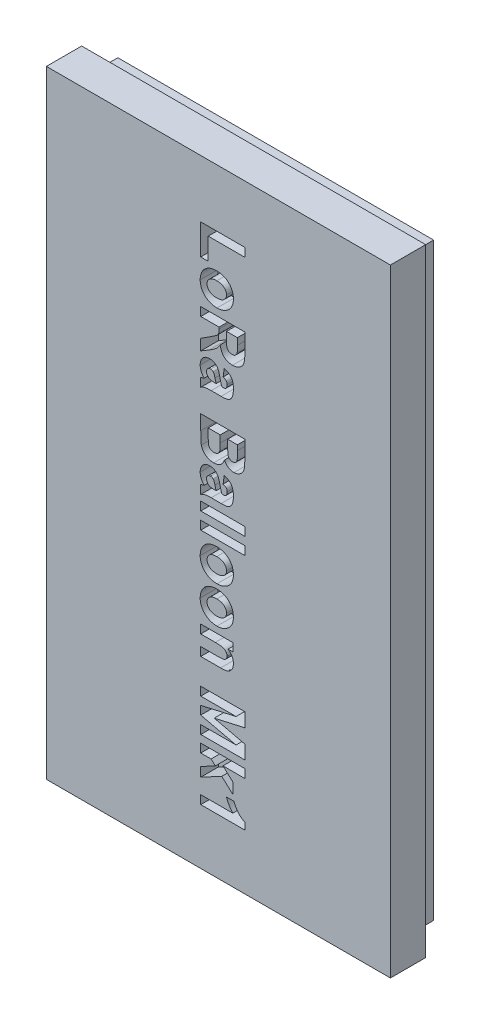
from build123d import *

# Parameters (mm, degrees)
SKETCH1_W           = 39
SKETCH1_H           = 70
BOSS_EXTRUDE1_DEPTH = 4
SKETCH2_W           = 35.8
SKETCH2_H           = 66.8
SKETCH2_W_2         = 32.2
SKETCH2_H_2         = 63.2
BOSS_EXTRUDE2_DEPTH = 2.5
SKETCH3_W           = 5
SKETCH3_H           = 0.974025974
CUT_EXTRUDE1_DEPTH  = 2


with BuildPart() as part:
    # Sketch1 → Boss-Extrude1 (new body)
    with BuildSketch(Plane.XY):
        with Locations((19.5, 35)):
            Rectangle(SKETCH1_W, SKETCH1_H)
    extrude(amount=BOSS_EXTRUDE1_DEPTH)

    # Sketch2 → Boss-Extrude2 (add)
    with BuildSketch(Plane(origin=(0, 0, 0), x_dir=(-1, 0, 0), z_dir=(0, 0, -1))):
        with Locations((-19.5, 35)):
            Rectangle(SKETCH2_W, SKETCH2_H)
        with Locations((-19.5, 35)):
            Rectangle(SKETCH2_W_2, SKETCH2_H_2, mode=Mode.SUBTRACT)
    extrude(amount=BOSS_EXTRUDE2_DEPTH)

    # Sketch3 → Cut-Extrude1 (cut)
    # profile 1 of 14: a face of its own
    with BuildSketch(Plane.XY.offset(4)):
        Polygon((17.5, 63.480519481), (22.5, 63.480519481), (22.5, 62.506493506), (18.344155844, 62.506493506), (18.344155844, 60.038961039), (17.5, 60.038961039), align=None)
    # profile 2 of 14: a face of its own
    with BuildSketch(Plane.XY.offset(4)):
        with BuildLine():
            add(Edge.make_bspline(
                [(19.368912338, 59.584415584), (19.412557514, 59.583528419), (19.49897445, 59.581771843), (19.627236649, 59.5710115), (19.752443405, 59.550019945), (19.874785917, 59.522884131), (19.994516204, 59.488790148), (20.110184764, 59.444132033), (20.223974613, 59.394264811), (20.333175225, 59.334768256), (20.438197721, 59.270617637), (20.536987544, 59.200578377), (20.628149795, 59.124897448), (20.714126756, 59.046482053), (20.791131896, 58.96084051), (20.863823807, 58.87250186), (20.92718966, 58.777238739), (20.985571825, 58.679054138), (21.035971814, 58.57595743), (21.08098851, 58.470239525), (21.116953951, 58.36023349), (21.149170134, 58.248554471), (21.171961312, 58.132698684), (21.189429104, 58.014236637), (21.199791408, 57.892231578), (21.200792678, 57.809881336), (21.201298701, 57.768262987)],
                knots=[0, 0, 0, 0, 1.087797627, 2.153826546, 3.204146119, 4.249074796, 5.276002369, 6.302929943, 7.33671768, 8.369955531, 9.399197913, 10.402506754, 11.384561342, 12.350717656, 13.299250364, 14.252266119, 15.199037181, 16.147307724, 17.097187567, 18.056740571, 19.008264324, 19.97962709, 20.951574749, 21.948063114, 22.962987564, 24, 24, 24, 24], degree=3))
            add(Edge.make_bspline(
                [(21.201298701, 57.768262987), (21.199450512, 57.699196986), (21.195849872, 57.564642667), (21.170584758, 57.368376346), (21.126764803, 57.183837211), (21.066175813, 57.009883847), (20.986134267, 56.848038854), (20.89046985, 56.696280054), (20.776185609, 56.556703738), (20.645110832, 56.431081694), (20.503737769, 56.317759151), (20.354365117, 56.219397997), (20.199648716, 56.135604234), (20.038921137, 56.06728619), (19.872434276, 56.012800493), (19.69920372, 55.976348227), (19.520815843, 55.951385416), (19.399776993, 55.949172654), (19.338474026, 55.948051948)],
                knots=[0, 0, 0, 0, 1.136040707, 2.213233445, 3.248238065, 4.25119704, 5.236487175, 6.211911138, 7.196384178, 8.195725979, 9.1931767, 10.173001403, 11.133846892, 12.083513917, 13.042376269, 14.010298635, 14.992269034, 16, 16, 16, 16], degree=3))
            add(Edge.make_bspline(
                [(19.338474026, 55.948051948), (19.292785106, 55.948788827), (19.202258032, 55.950248863), (19.068171932, 55.963209219), (18.937242639, 55.981822592), (18.809553931, 56.009724143), (18.685290231, 56.044636463), (18.564480208, 56.089004836), (18.44727316, 56.140577304), (18.333494925, 56.199149596), (18.225970918, 56.265135773), (18.123494513, 56.334835969), (18.029544059, 56.411267865), (17.941646307, 56.491770536), (17.860288246, 56.576913906), (17.78604347, 56.667487133), (17.718822759, 56.763088903), (17.659365223, 56.863436801), (17.60640402, 56.967101274), (17.560648674, 57.073877485), (17.522295574, 57.183113435), (17.490858341, 57.294665106), (17.464721949, 57.408267799), (17.448553753, 57.525095631), (17.436196394, 57.643879325), (17.435443702, 57.723924483), (17.435064935, 57.764204545)],
                knots=[0, 0, 0, 0, 1.117558833, 2.214307803, 3.293244786, 4.351421184, 5.409597582, 6.448807362, 7.497331125, 8.540978692, 9.576922014, 10.582241184, 11.570837346, 12.537122916, 13.496974449, 14.449450387, 15.399839374, 16.353464778, 17.300823134, 18.246083241, 19.193441597, 20.131138339, 21.080698472, 22.042616426, 23.015011865, 24, 24, 24, 24], degree=3))
            add(Edge.make_bspline(
                [(17.435064935, 57.764204545), (17.436658538, 57.82819482), (17.439789185, 57.953904305), (17.463432675, 58.138408962), (17.502852243, 58.314388167), (17.558226745, 58.482119319), (17.627904833, 58.641994397), (17.714623801, 58.793107632), (17.81848662, 58.934619784), (17.935324792, 59.068380592), (18.067007303, 59.190741631), (18.213695075, 59.296408751), (18.373969277, 59.385342747), (18.547080851, 59.458460327), (18.733816486, 59.515186359), (18.933919374, 59.555416358), (19.147111308, 59.580032759), (19.2937634, 59.582930629), (19.368912338, 59.584415584)],
                knots=[0, 0, 0, 0, 1.024594995, 2.012826322, 2.973358778, 3.908543225, 4.837401023, 5.761810751, 6.69243552, 7.644223827, 8.602462928, 9.564551743, 10.532007457, 11.531954493, 12.568505162, 13.651979317, 14.796803673, 16, 16, 16, 16], degree=3))
        make_face()
        with BuildLine():
            add(Edge.make_bspline(
                [(19.318181818, 58.61038961), (19.274202345, 58.609514753), (19.188802006, 58.607815935), (19.06447938, 58.597454177), (18.948875339, 58.576133409), (18.840572969, 58.551320566), (18.74158396, 58.514609688), (18.649820783, 58.472887948), (18.56681123, 58.421567934), (18.493039432, 58.362821614), (18.42822013, 58.298508427), (18.370720871, 58.231285957), (18.322007126, 58.160767582), (18.282867351, 58.08637229), (18.252505923, 58.009070471), (18.22979593, 57.928280791), (18.216410588, 57.84413299), (18.214997021, 57.786910979), (18.214285714, 57.758116883)],
                knots=[0, 0, 0, 0, 1.347985487, 2.617548842, 3.817114289, 4.948286482, 6.017057593, 7.046407217, 8.032969353, 8.999289909, 9.930051738, 10.827140183, 11.706817169, 12.550594062, 13.397420762, 14.247349517, 15.118066881, 16, 16, 16, 16], degree=3))
            add(Edge.make_bspline(
                [(18.214285714, 57.758116883), (18.214996693, 57.729997883), (18.216409584, 57.674118493), (18.22979937, 57.591986829), (18.252500735, 57.513209195), (18.283226956, 57.437266744), (18.322589441, 57.364118347), (18.372121703, 57.295009085), (18.429215162, 57.228477216), (18.495143433, 57.165972865), (18.568962581, 57.10742814), (18.652801437, 57.057929707), (18.744850541, 57.016383128), (18.844755807, 56.9820163), (18.95291975, 56.954389132), (19.06972451, 56.935560347), (19.194861198, 56.924502338), (19.280956327, 56.922901926), (19.325284091, 56.922077922)],
                knots=[0, 0, 0, 0, 0.86498205, 1.718932724, 2.552529207, 3.383717481, 4.236080589, 5.102502034, 5.995588818, 6.930639414, 7.894730959, 8.889086482, 9.918564038, 10.998334367, 12.1369617, 13.350269694, 14.635734454, 16, 16, 16, 16], degree=3))
            add(Edge.make_bspline(
                [(19.325284091, 56.922077922), (19.368590511, 56.92294123), (19.452647024, 56.924616887), (19.574907493, 56.935124228), (19.689038528, 56.955995868), (19.795406311, 56.98277939), (19.894048552, 57.017465181), (19.984674312, 57.059961661), (20.067601966, 57.110789288), (20.141273702, 57.170017786), (20.207179656, 57.233571266), (20.264268467, 57.301112354), (20.313794055, 57.371246694), (20.353151989, 57.445402526), (20.383867427, 57.522357638), (20.406564098, 57.602146516), (20.419954045, 57.685284735), (20.421366945, 57.74183557), (20.422077922, 57.770292208)],
                knots=[0, 0, 0, 0, 1.337232047, 2.595528913, 3.783536199, 4.915617704, 5.97906533, 7.006690339, 8.000659516, 8.974235141, 9.919454987, 10.823278711, 11.700968276, 12.565199868, 13.408680491, 14.254935835, 15.121875735, 16, 16, 16, 16], degree=3))
            add(Edge.make_bspline(
                [(20.422077922, 57.770292208), (20.421415795, 57.798756777), (20.420115523, 57.854654965), (20.40626498, 57.937027866), (20.384085777, 58.015940839), (20.353098004, 58.092139731), (20.313828021, 58.165346709), (20.263910312, 58.234471195), (20.207514915, 58.301932386), (20.141196663, 58.364462993), (20.067164898, 58.422965991), (19.98383727, 58.473238788), (19.892800776, 58.516296387), (19.793326134, 58.550568631), (19.686106775, 58.57781848), (19.57038669, 58.59703671), (19.446909753, 58.607908449), (19.361831476, 58.609548287), (19.318181818, 58.61038961)],
                knots=[0, 0, 0, 0, 0.8777483, 1.723705717, 2.56959874, 3.403036217, 4.257705828, 5.126471818, 6.029908573, 6.967489424, 7.934189811, 8.936630112, 9.963815147, 11.036651848, 12.178360317, 13.374360467, 14.652907978, 16, 16, 16, 16], degree=3))
        make_face(mode=Mode.SUBTRACT)
    # profile 3 of 14: a face of its own
    with BuildSketch(Plane.XY.offset(4)):
        with BuildLine():
            Line((17.5, 55.168831169), (22.5, 55.168831169))
            Line((22.5, 55.168831169), (22.5, 53.110186688))
            add(Edge.make_bspline(
                [(22.5, 53.110186688), (22.49959964, 53.046602106), (22.498828535, 52.924136317), (22.493283254, 52.747468762), (22.481516393, 52.585151171), (22.468334076, 52.43675353), (22.44896646, 52.30271048), (22.42582199, 52.182450855), (22.399160183, 52.076128095), (22.35746947, 51.953987396), (22.289037207, 51.817258993), (22.182950283, 51.66927317), (22.052390783, 51.53611038), (21.925015541, 51.43986879), (21.812438114, 51.37314975), (21.723389173, 51.327896019), (21.629222447, 51.291835754), (21.531340355, 51.261110267), (21.429311402, 51.236872009), (21.322862278, 51.219582969), (21.212666288, 51.209296583), (21.137738396, 51.208297549), (21.099837662, 51.207792208)],
                knots=[0, 0, 0, 0, 1.403336213, 2.702867097, 3.89994726, 4.994709233, 5.990128961, 6.887471613, 7.696701944, 8.407207329, 9.732421867, 11.053910544, 12.410433107, 13.833109191, 14.562763883, 15.297137368, 16.03453921, 16.78526912, 17.560138056, 18.346710252, 19.163717375, 20, 20, 20, 20], degree=3))
            add(Edge.make_bspline(
                [(21.099837662, 51.207792208), (21.05209605, 51.208614176), (20.95868939, 51.21022236), (20.822344048, 51.22725247), (20.692703782, 51.252832759), (20.570856368, 51.291197991), (20.454791296, 51.337103071), (20.347190843, 51.396787046), (20.24618256, 51.465982623), (20.152440065, 51.5452996), (20.067090469, 51.635039834), (19.990096905, 51.733862805), (19.920315295, 51.840706945), (19.860965804, 51.957551266), (19.807585822, 52.082277929), (19.764568325, 52.216986165), (19.728740241, 52.360000336), (19.712183605, 52.459007884), (19.703733766, 52.509537338)],
                knots=[0, 0, 0, 0, 1.084141299, 2.12112686, 3.117250271, 4.082180618, 5.019674211, 5.948149429, 6.871043381, 7.797863675, 8.732676681, 9.679570512, 10.640822351, 11.627176691, 12.653315453, 13.72007994, 14.836420889, 16, 16, 16, 16], degree=3))
            add(Edge.make_bspline(
                [(19.703733766, 52.509537338), (19.672285899, 52.457018332), (19.611037345, 52.354731166), (19.509893003, 52.212066964), (19.404961729, 52.083111517), (19.310752977, 51.984867186), (19.227578847, 51.909973227), (19.154264031, 51.850296479), (19.069920557, 51.786454973), (18.973984887, 51.718383278), (18.866785434, 51.645602751), (18.747978614, 51.56859415), (18.617651859, 51.487241259), (18.526522549, 51.432236426), (18.479099026, 51.403612013)],
                knots=[0, 0, 0, 0, 1.316447784, 2.563942512, 3.758196669, 4.89017242, 5.487731481, 6.164970468, 6.923081098, 7.76291089, 8.695186333, 9.710230341, 10.808408125, 12, 12, 12, 12], degree=3))
            Line((18.479099026, 51.403612013), (17.5, 50.818181818))
            Line((17.5, 50.818181818), (17.5, 52.052962662))
            Line((17.5, 52.052962662), (18.576501623, 52.745941558))
            add(Edge.make_bspline(
                [(18.576501623, 52.745941558), (18.622838875, 52.776035915), (18.711185346, 52.833413728), (18.836924232, 52.915199926), (18.948969559, 52.989958436), (19.048256469, 53.055680165), (19.132514105, 53.116606493), (19.204439987, 53.16757582), (19.262804516, 53.211341042), (19.321633384, 53.258982938), (19.380679389, 53.315703915), (19.440089246, 53.3840759), (19.486730917, 53.455464852), (19.523082043, 53.531650484), (19.549023303, 53.620907303), (19.56623292, 53.72849369), (19.575452702, 53.858133753), (19.577057051, 53.951622344), (19.577922078, 54.002029221)],
                knots=[0, 0, 0, 0, 1.540630534, 2.937361724, 4.182336204, 5.296545873, 6.256860607, 7.081241145, 7.754565199, 8.290682583, 9.191113071, 10.033949391, 10.810788607, 11.561665679, 12.379113064, 13.39303176, 14.594383257, 16, 16, 16, 16], degree=3))
            Line((19.577922078, 54.002029221), (19.577922078, 54.194805195))
            Line((19.577922078, 54.194805195), (17.5, 54.194805195))
            Line((17.5, 54.194805195), (17.5, 55.168831169))
        make_face()
        with BuildLine():
            Line((20.422077922, 54.194805195), (20.422077922, 53.480519481))
            add(Edge.make_bspline(
                [(20.422077922, 53.480519481), (20.422360992, 53.428436187), (20.422899583, 53.329338772), (20.424522386, 53.187944599), (20.428762736, 53.061455316), (20.433738572, 52.949833792), (20.439463925, 52.853034526), (20.447175783, 52.771067013), (20.45718866, 52.704030712), (20.471404412, 52.635039214), (20.497429019, 52.56218402), (20.541179974, 52.485039129), (20.595020472, 52.414693496), (20.662845147, 52.354665816), (20.74267145, 52.305026133), (20.835511744, 52.270942117), (20.939989681, 52.25048374), (21.013494264, 52.248038972), (21.052150974, 52.246753247)],
                knots=[0, 0, 0, 0, 1.560937284, 2.96995135, 4.237567709, 5.353650601, 6.318464703, 7.143454388, 7.820048429, 8.348858403, 9.25293029, 10.124191563, 10.998043079, 11.895328271, 12.823620657, 13.798761283, 14.842349086, 16, 16, 16, 16], degree=3))
            add(Edge.make_bspline(
                [(21.052150974, 52.246753247), (21.089110033, 52.248089887), (21.159913547, 52.250650527), (21.260502807, 52.270707591), (21.349801982, 52.30534349), (21.426865286, 52.354919176), (21.492474654, 52.4165156), (21.546236077, 52.488760187), (21.591503058, 52.569477796), (21.609903288, 52.629161273), (21.619318182, 52.659699675)],
                knots=[0, 0, 0, 0, 1.164311867, 2.230505154, 3.21629184, 4.165493112, 5.100643873, 6.036584124, 6.995373831, 8, 8, 8, 8], degree=3))
            add(Edge.make_bspline(
                [(21.619318182, 52.659699675), (21.622152214, 52.673542437), (21.628891215, 52.706458933), (21.636815241, 52.764342618), (21.642174412, 52.838215662), (21.647313084, 52.927849931), (21.651101857, 53.033393596), (21.654449891, 53.155147368), (21.654715225, 53.292818734), (21.655454959, 53.389881783), (21.655844156, 53.440949675)],
                knots=[0, 0, 0, 0, 0.432971861, 1.029557334, 1.788740938, 2.702316591, 3.781055348, 5.025222918, 6.434877167, 8, 8, 8, 8], degree=3))
            Line((21.655844156, 53.440949675), (21.655844156, 54.194805195))
            Line((21.655844156, 54.194805195), (20.422077922, 54.194805195))
        make_face(mode=Mode.SUBTRACT)
    # profile 4 of 14: a face of its own
    with BuildSketch(Plane.XY.offset(4)):
        with BuildLine():
            Line((20.032467532, 49.519480519), (20.162337662, 50.428571429))
            add(Edge.make_bspline(
                [(20.162337662, 50.428571429), (20.20719306, 50.415691623), (20.294450645, 50.390636429), (20.418210578, 50.34335307), (20.533095669, 50.292058446), (20.637670757, 50.2327813), (20.733439233, 50.168522975), (20.818332941, 50.09658976), (20.893880795, 50.019221267), (20.960550687, 49.935474488), (21.018112561, 49.843478314), (21.067731107, 49.742880485), (21.109302392, 49.632741745), (21.142396799, 49.513422221), (21.168715692, 49.384935912), (21.187893956, 49.247034659), (21.198845125, 49.099609618), (21.20046527, 48.998327146), (21.201298701, 48.946225649)],
                knots=[0, 0, 0, 0, 1.125515524, 2.189474865, 3.193709533, 4.158305409, 5.086274303, 5.972285183, 6.837881566, 7.691743787, 8.549806887, 9.451203831, 10.393874208, 11.385866739, 12.435713252, 13.556277782, 14.742906037, 16, 16, 16, 16], degree=3))
            add(Edge.make_bspline(
                [(21.201298701, 48.946225649), (21.201065942, 48.899877691), (21.200613715, 48.809828678), (21.192639745, 48.678941652), (21.183453447, 48.556293549), (21.168254125, 48.442124789), (21.147871153, 48.336527011), (21.123918854, 48.239177262), (21.095484812, 48.150333568), (21.053298642, 48.045537469), (20.990036334, 47.930029242), (20.901736264, 47.808898551), (20.798905797, 47.710331005), (20.701948242, 47.644080397), (20.613079567, 47.60315076), (20.533918189, 47.577669987), (20.442731226, 47.555247458), (20.339287857, 47.537500848), (20.223475224, 47.523487201), (20.095514823, 47.513621989), (19.955416661, 47.507532466), (19.857961248, 47.506849219), (19.807224026, 47.506493506)],
                knots=[0, 0, 0, 0, 1.172645795, 2.278322549, 3.317437237, 4.284552983, 5.190951134, 6.037858116, 6.820064311, 7.549551753, 8.893788561, 10.141635195, 11.328036199, 12.481663495, 13.094362176, 13.79803918, 14.582676335, 15.469136844, 16.45214095, 17.533908717, 18.716103928, 20, 20, 20, 20], degree=3))
            Line((19.807224026, 47.506493506), (18.689123377, 47.51461039))
            add(Edge.make_bspline(
                [(18.689123377, 47.51461039), (18.651245726, 47.514294596), (18.577852753, 47.513682703), (18.471594239, 47.512431592), (18.372858153, 47.506800527), (18.281554432, 47.500655264), (18.197471505, 47.494505328), (18.121165633, 47.483591402), (18.052284959, 47.473158955), (17.969560894, 47.455108068), (17.869356028, 47.42503735), (17.74867523, 47.378093511), (17.624021205, 47.319072636), (17.542270007, 47.271401782), (17.5, 47.246753247)],
                knots=[0, 0, 0, 0, 1.100960395, 2.13325684, 3.08799504, 3.974623839, 4.793377983, 5.537123068, 6.214225653, 6.817686965, 7.996461938, 9.250537039, 10.578371695, 12, 12, 12, 12], degree=3))
            Line((17.5, 47.246753247), (17.5, 48.220779221))
            Line((17.5, 48.220779221), (17.897727273, 48.339488636))
            add(Edge.make_bspline(
                [(17.897727273, 48.339488636), (17.859360735, 48.378659846), (17.784707234, 48.454879074), (17.688641004, 48.579374361), (17.607826166, 48.707185677), (17.543543882, 48.840060964), (17.494429822, 48.977200236), (17.460175543, 49.118356728), (17.439245859, 49.263849149), (17.436470563, 49.362146366), (17.435064935, 49.411931818)],
                knots=[0, 0, 0, 0, 1.094238684, 2.129166538, 3.133671034, 4.10942336, 5.070833053, 6.037377746, 7.005973528, 8, 8, 8, 8], degree=3))
            add(Edge.make_bspline(
                [(17.435064935, 49.411931818), (17.436196198, 49.452883747), (17.438417837, 49.533307461), (17.451225957, 49.651233519), (17.474624664, 49.763299387), (17.5076296, 49.869303813), (17.547536028, 49.970535302), (17.599137275, 50.065280202), (17.658950235, 50.154839855), (17.72770078, 50.238115806), (17.804914915, 50.312403446), (17.886913645, 50.37988358), (17.977266308, 50.433812533), (18.071973861, 50.480965293), (18.174096818, 50.514377114), (18.281528935, 50.540376537), (18.395128698, 50.555597497), (18.472967275, 50.557482325), (18.512581169, 50.558441558)],
                knots=[0, 0, 0, 0, 1.111028414, 2.181900458, 3.212888925, 4.21115239, 5.190734394, 6.159429897, 7.131421471, 8.108723925, 9.081883785, 10.034678926, 10.981892532, 11.929727932, 12.898727489, 13.888948844, 14.925636122, 16, 16, 16, 16], degree=3))
            add(Edge.make_bspline(
                [(18.512581169, 50.558441558), (18.562728581, 50.556889309), (18.660210948, 50.553871867), (18.801417536, 50.530305427), (18.932652513, 50.49093437), (19.053137607, 50.434421777), (19.162868726, 50.36437675), (19.262007438, 50.281256988), (19.348206816, 50.183941956), (19.411268145, 50.092633998), (19.457348311, 50.010976391), (19.488801873, 49.939353837), (19.521903707, 49.860662202), (19.551693844, 49.772493261), (19.582392237, 49.676262773), (19.611730086, 49.571066917), (19.638745813, 49.456793731), (19.656154942, 49.377796886), (19.665178571, 49.336850649)],
                knots=[0, 0, 0, 0, 1.294162278, 2.515743014, 3.684113667, 4.820865117, 5.939906549, 7.036651616, 8.149715676, 9.285662014, 9.895437351, 10.567486448, 11.303637924, 12.098932185, 12.968810962, 13.91153998, 14.917493754, 16, 16, 16, 16], degree=3))
            add(Edge.make_bspline(
                [(19.665178571, 49.336850649), (19.675447193, 49.287425487), (19.695178402, 49.192454782), (19.727063699, 49.056316793), (19.757224442, 48.931779605), (19.786558499, 48.818685487), (19.815533819, 48.717366448), (19.845353454, 48.627940328), (19.873024169, 48.549807839), (19.893250832, 48.502417949), (19.902597403, 48.480519481)],
                knots=[0, 0, 0, 0, 1.361164628, 2.615484881, 3.770095419, 4.816364149, 5.765912261, 6.610903979, 7.358110453, 8, 8, 8, 8], degree=3))
            add(Edge.make_bspline(
                [(19.902597403, 48.480519481), (19.946562127, 48.481232522), (20.026443529, 48.482528078), (20.134084546, 48.488297217), (20.217051281, 48.500778797), (20.279754281, 48.51823568), (20.326272153, 48.546991338), (20.366333468, 48.581441425), (20.40050469, 48.626229317), (20.431853941, 48.678910853), (20.457013728, 48.742456573), (20.475081855, 48.817171002), (20.484463112, 48.903377417), (20.486127741, 48.964468224), (20.487012987, 48.996956169)],
                knots=[0, 0, 0, 0, 1.704637254, 3.09722893, 4.172654963, 4.956246112, 5.596985007, 6.275246559, 6.99385986, 7.769515704, 8.645866914, 9.631493719, 10.740434052, 12, 12, 12, 12], degree=3))
            add(Edge.make_bspline(
                [(20.487012987, 48.996956169), (20.486048403, 49.030216444), (20.484220622, 49.093241041), (20.46511142, 49.182020678), (20.436865352, 49.260706291), (20.392081016, 49.328409486), (20.331148168, 49.387726745), (20.250139095, 49.438941536), (20.148822864, 49.484227608), (20.07303212, 49.50719041), (20.032467532, 49.519480519)],
                knots=[0, 0, 0, 0, 1.045871977, 1.981813381, 2.848317391, 3.663751395, 4.514929533, 5.507645304, 6.666046366, 8, 8, 8, 8], degree=3))
        make_face()
        with BuildLine():
            add(Edge.make_bspline(
                [(19.253246753, 48.480519481), (19.242902471, 48.510215942), (19.219887127, 48.576288602), (19.186657715, 48.687280513), (19.151554448, 48.820434594), (19.127949707, 48.916761496), (19.11525974, 48.968547078)],
                knots=[0, 0, 0, 0, 0.743632693, 1.654533494, 2.73907137, 4, 4, 4, 4], degree=3))
            add(Edge.make_bspline(
                [(19.11525974, 48.968547078), (19.107773576, 48.999066387), (19.09347914, 49.057341404), (19.068312447, 49.139900909), (19.045017306, 49.214838789), (19.018856579, 49.281109366), (18.994468642, 49.339977222), (18.967850056, 49.390138496), (18.940858395, 49.432128311), (18.920695301, 49.455743787), (18.911323052, 49.466720779)],
                knots=[0, 0, 0, 0, 1.388607462, 2.65147299, 3.814389992, 4.855436495, 5.799565367, 6.62877246, 7.362623276, 8, 8, 8, 8], degree=3))
            add(Edge.make_bspline(
                [(18.911323052, 49.466720779), (18.8921243, 49.48498234), (18.854201425, 49.521054002), (18.783420009, 49.55770184), (18.705480812, 49.580926081), (18.650404864, 49.583232655), (18.622159091, 49.584415584)],
                knots=[0, 0, 0, 0, 0.985740837, 1.947112291, 2.947173789, 4, 4, 4, 4], degree=3))
            add(Edge.make_bspline(
                [(18.622159091, 49.584415584), (18.589843357, 49.583021662), (18.527262696, 49.580322278), (18.437477164, 49.554408327), (18.355250624, 49.514023038), (18.283687216, 49.456492464), (18.22311162, 49.388656918), (18.18117901, 49.308680508), (18.153141138, 49.221698667), (18.150630123, 49.160194587), (18.149350649, 49.128855519)],
                knots=[0, 0, 0, 0, 1.056198986, 2.045369905, 3.036276429, 4.038084886, 5.035473036, 5.992159802, 6.976916006, 8, 8, 8, 8], degree=3))
            add(Edge.make_bspline(
                [(18.149350649, 49.128855519), (18.150811117, 49.099659231), (18.153749602, 49.040915817), (18.175060673, 48.953250177), (18.210348574, 48.866593217), (18.257143782, 48.781964229), (18.313408733, 48.704238415), (18.377238864, 48.638276618), (18.445522965, 48.584698065), (18.508215375, 48.550164762), (18.564336552, 48.52974552), (18.614132649, 48.517350335), (18.671106722, 48.504488836), (18.73599926, 48.496175812), (18.8083937, 48.488942309), (18.888609575, 48.484087177), (18.976572048, 48.481042641), (19.037808259, 48.480698276), (19.069602273, 48.480519481)],
                knots=[0, 0, 0, 0, 1.093500888, 2.200141778, 3.360346716, 4.591280596, 5.815607582, 6.94487563, 8.019710678, 9.057444999, 9.610729159, 10.253199895, 10.979011171, 11.798077413, 12.702238226, 13.705425431, 14.808650418, 16, 16, 16, 16], degree=3))
            Line((19.069602273, 48.480519481), (19.253246753, 48.480519481))
        make_face(mode=Mode.SUBTRACT)
    # profile 5 of 14: a face of its own
    with BuildSketch(Plane.XY.offset(4)):
        with BuildLine():
            Line((22.5, 44.649350649), (22.5, 42.67288961))
            add(Edge.make_bspline(
                [(22.5, 42.67288961), (22.499510508, 42.607953461), (22.498569611, 42.483133666), (22.49422381, 42.303102482), (22.483811423, 42.138364666), (22.470564301, 41.988512548), (22.455512523, 41.853521205), (22.43354904, 41.733531783), (22.410454756, 41.628078623), (22.372346197, 41.508564591), (22.311256991, 41.374074499), (22.214593191, 41.227673845), (22.095034223, 41.094011681), (21.97810006, 40.996078395), (21.8757626, 40.925997023), (21.795897158, 40.878833509), (21.712358841, 40.840481963), (21.626704996, 40.8092457), (21.539220203, 40.78290298), (21.448294252, 40.766638427), (21.355175757, 40.754383036), (21.291979777, 40.753627393), (21.260146104, 40.753246753)],
                knots=[0, 0, 0, 0, 1.498327689, 2.88007457, 4.154414764, 5.305986542, 6.351317343, 7.286582663, 8.11946184, 8.840080679, 10.177555878, 11.512935148, 12.872513647, 14.301275782, 15.019863751, 15.733221227, 16.438466007, 17.137161526, 17.836031326, 18.543086972, 19.26611006, 20, 20, 20, 20], degree=3))
            add(Edge.make_bspline(
                [(21.260146104, 40.753246753), (21.202105001, 40.755485812), (21.087543876, 40.759905252), (20.920765624, 40.79810736), (20.761932145, 40.858055109), (20.615000736, 40.943704109), (20.481401724, 41.047765172), (20.364799949, 41.167606909), (20.265191479, 41.301102254), (20.216326185, 41.400377793), (20.191761364, 41.450284091)],
                knots=[0, 0, 0, 0, 1.031817477, 2.036594177, 3.029254201, 4.043130586, 5.050931669, 6.034203586, 7.01178454, 8, 8, 8, 8], degree=3))
            add(Edge.make_bspline(
                [(20.191761364, 41.450284091), (20.180408131, 41.416287018), (20.157967235, 41.349088119), (20.116343614, 41.252659833), (20.06809293, 41.162227014), (20.015869675, 41.076187911), (19.955607962, 40.997337562), (19.890207728, 40.92405518), (19.820283436, 40.855071709), (19.742926309, 40.794197199), (19.662096521, 40.737461267), (19.575284811, 40.69015268), (19.484730675, 40.649429465), (19.389910421, 40.615433398), (19.290221661, 40.590554622), (19.186475614, 40.572312866), (19.078647266, 40.560901805), (19.005371576, 40.559270435), (18.968141234, 40.558441558)],
                knots=[0, 0, 0, 0, 1.053917501, 2.08318216, 3.084375989, 4.067115349, 5.039987852, 5.998256831, 6.954975631, 7.924383767, 8.890110205, 9.856297623, 10.826929889, 11.808561028, 12.814635272, 13.844956918, 14.905053061, 16, 16, 16, 16], degree=3))
            add(Edge.make_bspline(
                [(18.968141234, 40.558441558), (18.9227856, 40.559463749), (18.833877117, 40.5614675), (18.70319974, 40.575812502), (18.577900082, 40.600017259), (18.458161501, 40.634652918), (18.343560388, 40.678337479), (18.234505267, 40.732361982), (18.130887303, 40.796661174), (18.032915411, 40.869422249), (17.942563815, 40.948763771), (17.860795079, 41.032806893), (17.787141142, 41.119564208), (17.724510591, 41.211716821), (17.669294272, 41.306011839), (17.623026085, 41.403869017), (17.587612024, 41.505811991), (17.570479131, 41.575607427), (17.561891234, 41.610592532)],
                knots=[0, 0, 0, 0, 1.145607172, 2.24567906, 3.316329682, 4.365460088, 5.390414304, 6.410550385, 7.434792233, 8.46684308, 9.489944109, 10.468671886, 11.426900475, 12.36059261, 13.279351643, 14.185149476, 15.09030244, 16, 16, 16, 16], degree=3))
            add(Edge.make_bspline(
                [(17.561891234, 41.610592532), (17.556921702, 41.639303553), (17.545619634, 41.704600237), (17.532705073, 41.815630372), (17.523758584, 41.951103494), (17.513827495, 42.111024653), (17.50891179, 42.29544384), (17.503367379, 42.504435965), (17.500552852, 42.737817581), (17.500190272, 42.90151478), (17.5, 42.987418831)],
                knots=[0, 0, 0, 0, 0.506837559, 1.152686718, 1.943271314, 2.868501158, 3.939884368, 5.152247396, 6.505573166, 8, 8, 8, 8], degree=3))
            Line((17.5, 42.987418831), (17.5, 44.649350649))
            Line((17.5, 44.649350649), (22.5, 44.649350649))
        make_face()
        with BuildLine():
            Line((21.655844156, 43.675324675), (20.551948052, 43.675324675))
            Line((20.551948052, 43.675324675), (20.551948052, 43.011769481))
            add(Edge.make_bspline(
                [(20.551948052, 43.011769481), (20.551832573, 42.964420376), (20.551613161, 42.874455737), (20.553078644, 42.746619834), (20.553523744, 42.632968979), (20.556054718, 42.53355312), (20.557413467, 42.448626051), (20.561000441, 42.377977453), (20.563239725, 42.321405165), (20.566697363, 42.28834243), (20.568181818, 42.274147727)],
                knots=[0, 0, 0, 0, 1.539755574, 2.925579234, 4.157432792, 5.235486124, 6.159601295, 6.919197766, 7.535983151, 8, 8, 8, 8], degree=3))
            add(Edge.make_bspline(
                [(20.568181818, 42.274147727), (20.574850885, 42.233318916), (20.587561075, 42.155505632), (20.623558152, 42.046431326), (20.673053822, 41.95161873), (20.735797333, 41.87023717), (20.812202827, 41.80538307), (20.902673883, 41.759958125), (21.004824377, 41.731851843), (21.077324625, 41.728840143), (21.115056818, 41.727272727)],
                knots=[0, 0, 0, 0, 1.156043088, 2.203236031, 3.197816213, 4.134692963, 5.061434266, 5.975433912, 6.946330216, 8, 8, 8, 8], degree=3))
            add(Edge.make_bspline(
                [(21.115056818, 41.727272727), (21.149032561, 41.728367007), (21.214080817, 41.730462061), (21.306372262, 41.753914247), (21.389289762, 41.790138513), (21.46058487, 41.842794), (21.519444964, 41.905725062), (21.568910588, 41.974318265), (21.603119906, 42.050430891), (21.622591975, 42.120766342), (21.633137435, 42.189338769), (21.637857773, 42.260943637), (21.644929767, 42.352168788), (21.647622572, 42.462874611), (21.652717015, 42.593373033), (21.653579458, 42.743241676), (21.656517581, 42.91266634), (21.656076539, 43.032059799), (21.655844156, 43.094967532)],
                knots=[0, 0, 0, 0, 0.973031789, 1.862917975, 2.714444411, 3.555113712, 4.385861934, 5.180259999, 5.970734499, 6.766732084, 7.267820327, 7.959442945, 8.825288207, 9.893716152, 11.136763095, 12.573466007, 14.194578749, 16, 16, 16, 16], degree=3))
            Line((21.655844156, 43.094967532), (21.655844156, 43.675324675))
        make_face(mode=Mode.SUBTRACT)
        with BuildLine():
            Line((19.707792208, 43.675324675), (18.344155844, 43.675324675))
            Line((18.344155844, 43.675324675), (18.344155844, 42.766233766))
            add(Edge.make_bspline(
                [(18.344155844, 42.766233766), (18.344435303, 42.718547013), (18.344968481, 42.627565962), (18.346641239, 42.498007918), (18.350663013, 42.381978963), (18.356469428, 42.279101151), (18.364765581, 42.189499659), (18.373086671, 42.113174385), (18.384557964, 42.05062612), (18.39957062, 41.98492682), (18.429541772, 41.914725809), (18.476477375, 41.839130124), (18.536381147, 41.769891211), (18.609251223, 41.709452134), (18.694258039, 41.659140716), (18.790519448, 41.622489145), (18.897872497, 41.601068618), (18.972775625, 41.598657699), (19.011769481, 41.597402597)],
                knots=[0, 0, 0, 0, 1.468823539, 2.802352852, 3.990613231, 5.044577628, 5.97542194, 6.762296442, 7.407977832, 7.933490854, 8.834961323, 9.742609811, 10.665728169, 11.642033707, 12.646065455, 13.694610711, 14.799836276, 16, 16, 16, 16], degree=3))
            add(Edge.make_bspline(
                [(19.011769481, 41.597402597), (19.051778275, 41.599020552), (19.128740306, 41.602132894), (19.239002361, 41.624211472), (19.337981776, 41.66306157), (19.42512846, 41.717703956), (19.500471478, 41.784762229), (19.562788623, 41.863068947), (19.613692581, 41.950567204), (19.644200012, 42.033261763), (19.662826125, 42.109634469), (19.674179052, 42.180962413), (19.685933, 42.265086938), (19.69291111, 42.363053142), (19.700780449, 42.473920979), (19.703815078, 42.598478993), (19.70740735, 42.736113144), (19.707660088, 42.832518088), (19.707792208, 42.882913961)],
                knots=[0, 0, 0, 0, 1.143215143, 2.19912046, 3.197116365, 4.165365694, 5.123819291, 6.065802965, 7.014162653, 8.005206416, 8.5725482, 9.259043701, 10.068343003, 10.999502645, 12.064921609, 13.244816419, 14.559722402, 16, 16, 16, 16], degree=3))
            Line((19.707792208, 42.882913961), (19.707792208, 43.675324675))
        make_face(mode=Mode.SUBTRACT)
    # profile 6 of 14: a face of its own
    with BuildSketch(Plane.XY.offset(4)):
        with BuildLine():
            Line((20.032467532, 39), (20.162337662, 39.909090909))
            add(Edge.make_bspline(
                [(20.162337662, 39.909090909), (20.20719306, 39.896211104), (20.294450645, 39.87115591), (20.418210578, 39.823872551), (20.533095669, 39.772577927), (20.637670757, 39.71330078), (20.733439233, 39.649042456), (20.818332941, 39.577109241), (20.893880795, 39.499740748), (20.960550687, 39.415993968), (21.018112561, 39.323997794), (21.067731107, 39.223399966), (21.109302392, 39.113261226), (21.142396799, 38.993941702), (21.168715692, 38.865455392), (21.187893956, 38.72755414), (21.198845125, 38.580129098), (21.20046527, 38.478846626), (21.201298701, 38.42674513)],
                knots=[0, 0, 0, 0, 1.125515524, 2.189474865, 3.193709533, 4.158305409, 5.086274303, 5.972285183, 6.837881566, 7.691743787, 8.549806887, 9.451203831, 10.393874208, 11.385866739, 12.435713252, 13.556277782, 14.742906037, 16, 16, 16, 16], degree=3))
            add(Edge.make_bspline(
                [(21.201298701, 38.42674513), (21.201065942, 38.380397172), (21.200613715, 38.290348158), (21.192639745, 38.159461132), (21.183453447, 38.03681303), (21.168254125, 37.922644269), (21.147871153, 37.817046491), (21.123918854, 37.719696742), (21.095484812, 37.630853049), (21.053298642, 37.52605695), (20.990036334, 37.410548722), (20.901736264, 37.289418032), (20.798905797, 37.190850485), (20.701948242, 37.124599878), (20.613079567, 37.08367024), (20.533918189, 37.058189468), (20.442731226, 37.035766939), (20.339287857, 37.018020328), (20.223475224, 37.004006681), (20.095514823, 36.994141469), (19.955416661, 36.988051947), (19.857961248, 36.987368699), (19.807224026, 36.987012987)],
                knots=[0, 0, 0, 0, 1.172645795, 2.278322549, 3.317437237, 4.284552983, 5.190951134, 6.037858116, 6.820064311, 7.549551753, 8.893788561, 10.141635195, 11.328036199, 12.481663495, 13.094362176, 13.79803918, 14.582676335, 15.469136844, 16.45214095, 17.533908717, 18.716103928, 20, 20, 20, 20], degree=3))
            Line((19.807224026, 36.987012987), (18.689123377, 36.99512987))
            add(Edge.make_bspline(
                [(18.689123377, 36.99512987), (18.651245726, 36.994814076), (18.577852753, 36.994202183), (18.471594239, 36.992951072), (18.372858153, 36.987320007), (18.281554432, 36.981174744), (18.197471505, 36.975024809), (18.121165633, 36.964110883), (18.052284959, 36.953678435), (17.969560894, 36.935627548), (17.869356028, 36.90555683), (17.74867523, 36.858612991), (17.624021205, 36.799592116), (17.542270007, 36.751921263), (17.5, 36.727272727)],
                knots=[0, 0, 0, 0, 1.100960395, 2.13325684, 3.08799504, 3.974623839, 4.793377983, 5.537123068, 6.214225653, 6.817686965, 7.996461938, 9.250537039, 10.578371695, 12, 12, 12, 12], degree=3))
            Line((17.5, 36.727272727), (17.5, 37.701298701))
            Line((17.5, 37.701298701), (17.897727273, 37.820008117))
            add(Edge.make_bspline(
                [(17.897727273, 37.820008117), (17.859360735, 37.859179326), (17.784707234, 37.935398555), (17.688641004, 38.059893842), (17.607826166, 38.187705157), (17.543543882, 38.320580444), (17.494429822, 38.457719716), (17.460175543, 38.598876208), (17.439245859, 38.74436863), (17.436470563, 38.842665847), (17.435064935, 38.892451299)],
                knots=[0, 0, 0, 0, 1.094238684, 2.129166538, 3.133671034, 4.10942336, 5.070833053, 6.037377746, 7.005973528, 8, 8, 8, 8], degree=3))
            add(Edge.make_bspline(
                [(17.435064935, 38.892451299), (17.436196198, 38.933403227), (17.438417837, 39.013826941), (17.451225957, 39.131752999), (17.474624664, 39.243818867), (17.5076296, 39.349823293), (17.547536028, 39.451054783), (17.599137275, 39.545799682), (17.658950235, 39.635359335), (17.72770078, 39.718635287), (17.804914915, 39.792922926), (17.886913645, 39.86040306), (17.977266308, 39.914332014), (18.071973861, 39.961484773), (18.174096818, 39.994896594), (18.281528935, 40.020896018), (18.395128698, 40.036116978), (18.472967275, 40.038001805), (18.512581169, 40.038961039)],
                knots=[0, 0, 0, 0, 1.111028414, 2.181900458, 3.212888925, 4.21115239, 5.190734394, 6.159429897, 7.131421471, 8.108723925, 9.081883785, 10.034678926, 10.981892532, 11.929727932, 12.898727489, 13.888948844, 14.925636122, 16, 16, 16, 16], degree=3))
            add(Edge.make_bspline(
                [(18.512581169, 40.038961039), (18.562728581, 40.03740879), (18.660210948, 40.034391347), (18.801417536, 40.010824907), (18.932652513, 39.971453851), (19.053137607, 39.914941257), (19.162868726, 39.844896231), (19.262007438, 39.761776468), (19.348206816, 39.664461437), (19.411268145, 39.573153479), (19.457348311, 39.491495871), (19.488801873, 39.419873318), (19.521903707, 39.341181682), (19.551693844, 39.253012742), (19.582392237, 39.156782254), (19.611730086, 39.051586397), (19.638745813, 38.937313211), (19.656154942, 38.858316366), (19.665178571, 38.81737013)],
                knots=[0, 0, 0, 0, 1.294162278, 2.515743014, 3.684113667, 4.820865117, 5.939906549, 7.036651616, 8.149715676, 9.285662014, 9.895437351, 10.567486448, 11.303637924, 12.098932185, 12.968810962, 13.91153998, 14.917493754, 16, 16, 16, 16], degree=3))
            add(Edge.make_bspline(
                [(19.665178571, 38.81737013), (19.675447193, 38.767944968), (19.695178402, 38.672974263), (19.727063699, 38.536836273), (19.757224442, 38.412299085), (19.786558499, 38.299204968), (19.815533819, 38.197885928), (19.845353454, 38.108459808), (19.873024169, 38.03032732), (19.893250832, 37.982937429), (19.902597403, 37.961038961)],
                knots=[0, 0, 0, 0, 1.361164628, 2.615484881, 3.770095419, 4.816364149, 5.765912261, 6.610903979, 7.358110453, 8, 8, 8, 8], degree=3))
            add(Edge.make_bspline(
                [(19.902597403, 37.961038961), (19.946562127, 37.961752003), (20.026443529, 37.963047558), (20.134084546, 37.968816697), (20.217051281, 37.981298278), (20.279754281, 37.99875516), (20.326272153, 38.027510819), (20.366333468, 38.061960905), (20.40050469, 38.106748797), (20.431853941, 38.159430334), (20.457013728, 38.222976054), (20.475081855, 38.297690482), (20.484463112, 38.383896898), (20.486127741, 38.444987705), (20.487012987, 38.477475649)],
                knots=[0, 0, 0, 0, 1.704637254, 3.09722893, 4.172654963, 4.956246112, 5.596985007, 6.275246559, 6.99385986, 7.769515704, 8.645866914, 9.631493719, 10.740434052, 12, 12, 12, 12], degree=3))
            add(Edge.make_bspline(
                [(20.487012987, 38.477475649), (20.486048403, 38.510735925), (20.484220622, 38.573760521), (20.46511142, 38.662540159), (20.436865352, 38.741225771), (20.392081016, 38.808928966), (20.331148168, 38.868246226), (20.250139095, 38.919461016), (20.148822864, 38.964747089), (20.07303212, 38.98770989), (20.032467532, 39)],
                knots=[0, 0, 0, 0, 1.045871977, 1.981813381, 2.848317391, 3.663751395, 4.514929533, 5.507645304, 6.666046366, 8, 8, 8, 8], degree=3))
        make_face()
        with BuildLine():
            add(Edge.make_bspline(
                [(19.253246753, 37.961038961), (19.242902471, 37.990735422), (19.219887127, 38.056808082), (19.186657715, 38.167799993), (19.151554448, 38.300954074), (19.127949707, 38.397280976), (19.11525974, 38.449066558)],
                knots=[0, 0, 0, 0, 0.743632693, 1.654533494, 2.73907137, 4, 4, 4, 4], degree=3))
            add(Edge.make_bspline(
                [(19.11525974, 38.449066558), (19.107773576, 38.479585867), (19.09347914, 38.537860884), (19.068312447, 38.62042039), (19.045017306, 38.695358269), (19.018856579, 38.761628846), (18.994468642, 38.820496703), (18.967850056, 38.870657977), (18.940858395, 38.912647791), (18.920695301, 38.936263267), (18.911323052, 38.94724026)],
                knots=[0, 0, 0, 0, 1.388607462, 2.65147299, 3.814389992, 4.855436495, 5.799565367, 6.62877246, 7.362623276, 8, 8, 8, 8], degree=3))
            add(Edge.make_bspline(
                [(18.911323052, 38.94724026), (18.8921243, 38.965501821), (18.854201425, 39.001573483), (18.783420009, 39.038221321), (18.705480812, 39.061445562), (18.650404864, 39.063752135), (18.622159091, 39.064935065)],
                knots=[0, 0, 0, 0, 0.985740837, 1.947112291, 2.947173789, 4, 4, 4, 4], degree=3))
            add(Edge.make_bspline(
                [(18.622159091, 39.064935065), (18.589843357, 39.063541143), (18.527262696, 39.060841758), (18.437477164, 39.034927808), (18.355250624, 38.994542518), (18.283687216, 38.937011945), (18.22311162, 38.869176399), (18.18117901, 38.789199989), (18.153141138, 38.702218147), (18.150630123, 38.640714067), (18.149350649, 38.609375)],
                knots=[0, 0, 0, 0, 1.056198986, 2.045369905, 3.036276429, 4.038084886, 5.035473036, 5.992159802, 6.976916006, 8, 8, 8, 8], degree=3))
            add(Edge.make_bspline(
                [(18.149350649, 38.609375), (18.150811117, 38.580178711), (18.153749602, 38.521435298), (18.175060673, 38.433769658), (18.210348574, 38.347112698), (18.257143782, 38.26248371), (18.313408733, 38.184757896), (18.377238864, 38.118796099), (18.445522965, 38.065217546), (18.508215375, 38.030684242), (18.564336552, 38.010265001), (18.614132649, 37.997869815), (18.671106722, 37.985008317), (18.73599926, 37.976695293), (18.8083937, 37.96946179), (18.888609575, 37.964606658), (18.976572048, 37.961562122), (19.037808259, 37.961217756), (19.069602273, 37.961038961)],
                knots=[0, 0, 0, 0, 1.093500888, 2.200141778, 3.360346716, 4.591280596, 5.815607582, 6.94487563, 8.019710678, 9.057444999, 9.610729159, 10.253199895, 10.979011171, 11.798077413, 12.702238226, 13.705425431, 14.808650418, 16, 16, 16, 16], degree=3))
            Line((19.069602273, 37.961038961), (19.253246753, 37.961038961))
        make_face(mode=Mode.SUBTRACT)
    # profile 7 of 14: a face of its own
    with BuildSketch(Plane.XY.offset(4)):
        with Locations((20, 35.590909091)):
            Rectangle(SKETCH3_W, SKETCH3_H)
    # profile 8 of 14: a face of its own
    with BuildSketch(Plane.XY.offset(4)):
        with Locations((20, 33.707792208)):
            Rectangle(SKETCH3_W, SKETCH3_H)
    # profile 9 of 14: a face of its own
    with BuildSketch(Plane.XY.offset(4)):
        with BuildLine():
            add(Edge.make_bspline(
                [(19.368912338, 32.506493506), (19.412557514, 32.505606341), (19.49897445, 32.503849765), (19.627236649, 32.493089423), (19.752443405, 32.472097867), (19.874785917, 32.444962053), (19.994516204, 32.41086807), (20.110184764, 32.366209955), (20.223974613, 32.316342733), (20.333175225, 32.256846178), (20.438197721, 32.192695559), (20.536987544, 32.1226563), (20.628149795, 32.04697537), (20.714126756, 31.968559975), (20.791131896, 31.882918432), (20.863823807, 31.794579782), (20.92718966, 31.699316661), (20.985571825, 31.60113206), (21.035971814, 31.498035352), (21.08098851, 31.392317447), (21.116953951, 31.282311412), (21.149170134, 31.170632393), (21.171961312, 31.054776606), (21.189429104, 30.936314559), (21.199791408, 30.8143095), (21.200792678, 30.731959258), (21.201298701, 30.690340909)],
                knots=[0, 0, 0, 0, 1.087797627, 2.153826546, 3.204146119, 4.249074796, 5.276002369, 6.302929943, 7.33671768, 8.369955531, 9.399197913, 10.402506754, 11.384561342, 12.350717656, 13.299250364, 14.252266119, 15.199037181, 16.147307724, 17.097187567, 18.056740571, 19.008264324, 19.97962709, 20.951574749, 21.948063114, 22.962987564, 24, 24, 24, 24], degree=3))
            add(Edge.make_bspline(
                [(21.201298701, 30.690340909), (21.199450512, 30.621274908), (21.195849872, 30.486720589), (21.170584758, 30.290454268), (21.126764803, 30.105915134), (21.066175813, 29.931961769), (20.986134267, 29.770116776), (20.89046985, 29.618357976), (20.776185609, 29.47878166), (20.645110832, 29.353159616), (20.503737769, 29.239837073), (20.354365117, 29.141475919), (20.199648716, 29.057682156), (20.038921137, 28.989364112), (19.872434276, 28.934878415), (19.69920372, 28.898426149), (19.520815843, 28.873463338), (19.399776993, 28.871250576), (19.338474026, 28.87012987)],
                knots=[0, 0, 0, 0, 1.136040707, 2.213233445, 3.248238065, 4.25119704, 5.236487175, 6.211911138, 7.196384178, 8.195725979, 9.1931767, 10.173001403, 11.133846892, 12.083513917, 13.042376269, 14.010298635, 14.992269034, 16, 16, 16, 16], degree=3))
            add(Edge.make_bspline(
                [(19.338474026, 28.87012987), (19.292785106, 28.870866749), (19.202258032, 28.872326785), (19.068171932, 28.885287141), (18.937242639, 28.903900514), (18.809553931, 28.931802065), (18.685290231, 28.966714385), (18.564480208, 29.011082759), (18.44727316, 29.062655227), (18.333494925, 29.121227518), (18.225970918, 29.187213695), (18.123494513, 29.256913891), (18.029544059, 29.333345787), (17.941646307, 29.413848458), (17.860288246, 29.498991828), (17.78604347, 29.589565055), (17.718822759, 29.685166826), (17.659365223, 29.785514723), (17.60640402, 29.889179196), (17.560648674, 29.995955407), (17.522295574, 30.105191357), (17.490858341, 30.216743028), (17.464721949, 30.330345721), (17.448553753, 30.447173554), (17.436196394, 30.565957247), (17.435443702, 30.646002406), (17.435064935, 30.686282468)],
                knots=[0, 0, 0, 0, 1.117558833, 2.214307803, 3.293244786, 4.351421184, 5.409597582, 6.448807362, 7.497331125, 8.540978692, 9.576922014, 10.582241184, 11.570837346, 12.537122916, 13.496974449, 14.449450387, 15.399839374, 16.353464778, 17.300823134, 18.246083241, 19.193441597, 20.131138339, 21.080698472, 22.042616426, 23.015011865, 24, 24, 24, 24], degree=3))
            add(Edge.make_bspline(
                [(17.435064935, 30.686282468), (17.436658538, 30.750272742), (17.439789185, 30.875982227), (17.463432675, 31.060486884), (17.502852243, 31.236466089), (17.558226745, 31.404197241), (17.627904833, 31.56407232), (17.714623801, 31.715185554), (17.81848662, 31.856697706), (17.935324792, 31.990458515), (18.067007303, 32.112819554), (18.213695075, 32.218486673), (18.373969277, 32.307420669), (18.547080851, 32.380538249), (18.733816486, 32.437264282), (18.933919374, 32.47749428), (19.147111308, 32.502110682), (19.2937634, 32.505008551), (19.368912338, 32.506493506)],
                knots=[0, 0, 0, 0, 1.024594995, 2.012826322, 2.973358778, 3.908543225, 4.837401023, 5.761810751, 6.69243552, 7.644223827, 8.602462928, 9.564551743, 10.532007457, 11.531954493, 12.568505162, 13.651979317, 14.796803673, 16, 16, 16, 16], degree=3))
        make_face()
        with BuildLine():
            add(Edge.make_bspline(
                [(19.318181818, 31.532467532), (19.274202345, 31.531592675), (19.188802006, 31.529893857), (19.06447938, 31.519532099), (18.948875339, 31.498211332), (18.840572969, 31.473398488), (18.74158396, 31.436687611), (18.649820783, 31.39496587), (18.56681123, 31.343645856), (18.493039432, 31.284899536), (18.42822013, 31.220586349), (18.370720871, 31.153363879), (18.322007126, 31.082845504), (18.282867351, 31.008450212), (18.252505923, 30.931148393), (18.22979593, 30.850358713), (18.216410588, 30.766210912), (18.214997021, 30.708988901), (18.214285714, 30.680194805)],
                knots=[0, 0, 0, 0, 1.347985487, 2.617548842, 3.817114289, 4.948286482, 6.017057593, 7.046407217, 8.032969353, 8.999289909, 9.930051738, 10.827140183, 11.706817169, 12.550594062, 13.397420762, 14.247349517, 15.118066881, 16, 16, 16, 16], degree=3))
            add(Edge.make_bspline(
                [(18.214285714, 30.680194805), (18.214996693, 30.652075805), (18.216409584, 30.596196415), (18.22979937, 30.514064751), (18.252500735, 30.435287117), (18.283226956, 30.359344666), (18.322589441, 30.286196269), (18.372121703, 30.217087007), (18.429215162, 30.150555138), (18.495143433, 30.088050787), (18.568962581, 30.029506062), (18.652801437, 29.980007629), (18.744850541, 29.93846105), (18.844755807, 29.904094222), (18.95291975, 29.876467054), (19.06972451, 29.857638269), (19.194861198, 29.84658026), (19.280956327, 29.844979848), (19.325284091, 29.844155844)],
                knots=[0, 0, 0, 0, 0.86498205, 1.718932724, 2.552529207, 3.383717481, 4.236080589, 5.102502034, 5.995588818, 6.930639414, 7.894730959, 8.889086482, 9.918564038, 10.998334367, 12.1369617, 13.350269694, 14.635734454, 16, 16, 16, 16], degree=3))
            add(Edge.make_bspline(
                [(19.325284091, 29.844155844), (19.368590511, 29.845019153), (19.452647024, 29.846694809), (19.574907493, 29.85720215), (19.689038528, 29.87807379), (19.795406311, 29.904857312), (19.894048552, 29.939543103), (19.984674312, 29.982039583), (20.067601966, 30.03286721), (20.141273702, 30.092095708), (20.207179656, 30.155649188), (20.264268467, 30.223190276), (20.313794055, 30.293324616), (20.353151989, 30.367480448), (20.383867427, 30.44443556), (20.406564098, 30.524224438), (20.419954045, 30.607362658), (20.421366945, 30.663913492), (20.422077922, 30.69237013)],
                knots=[0, 0, 0, 0, 1.337232047, 2.595528913, 3.783536199, 4.915617704, 5.97906533, 7.006690339, 8.000659516, 8.974235141, 9.919454987, 10.823278711, 11.700968276, 12.565199868, 13.408680491, 14.254935835, 15.121875735, 16, 16, 16, 16], degree=3))
            add(Edge.make_bspline(
                [(20.422077922, 30.69237013), (20.421415795, 30.720834699), (20.420115523, 30.776732887), (20.40626498, 30.859105788), (20.384085777, 30.938018761), (20.353098004, 31.014217653), (20.313828021, 31.087424631), (20.263910312, 31.156549117), (20.207514915, 31.224010308), (20.141196663, 31.286540915), (20.067164898, 31.345043913), (19.98383727, 31.39531671), (19.892800776, 31.438374309), (19.793326134, 31.472646553), (19.686106775, 31.499896402), (19.57038669, 31.519114632), (19.446909753, 31.529986371), (19.361831476, 31.531626209), (19.318181818, 31.532467532)],
                knots=[0, 0, 0, 0, 0.8777483, 1.723705717, 2.56959874, 3.403036217, 4.257705828, 5.126471818, 6.029908573, 6.967489424, 7.934189811, 8.936630112, 9.963815147, 11.036651848, 12.178360317, 13.374360467, 14.652907978, 16, 16, 16, 16], degree=3))
        make_face(mode=Mode.SUBTRACT)
    # profile 10 of 14: a face of its own
    with BuildSketch(Plane.XY.offset(4)):
        with BuildLine():
            add(Edge.make_bspline(
                [(19.368912338, 28.350649351), (19.412557514, 28.349762186), (19.49897445, 28.348005609), (19.627236649, 28.337245267), (19.752443405, 28.316253711), (19.874785917, 28.289117897), (19.994516204, 28.255023914), (20.110184764, 28.210365799), (20.223974613, 28.160498577), (20.333175225, 28.101002022), (20.438197721, 28.036851403), (20.536987544, 27.966812144), (20.628149795, 27.891131215), (20.714126756, 27.812715819), (20.791131896, 27.727074276), (20.863823807, 27.638735626), (20.92718966, 27.543472505), (20.985571825, 27.445287904), (21.035971814, 27.342191196), (21.08098851, 27.236473291), (21.116953951, 27.126467256), (21.149170134, 27.014788237), (21.171961312, 26.89893245), (21.189429104, 26.780470403), (21.199791408, 26.658465344), (21.200792678, 26.576115102), (21.201298701, 26.534496753)],
                knots=[0, 0, 0, 0, 1.087797627, 2.153826546, 3.204146119, 4.249074796, 5.276002369, 6.302929943, 7.33671768, 8.369955531, 9.399197913, 10.402506754, 11.384561342, 12.350717656, 13.299250364, 14.252266119, 15.199037181, 16.147307724, 17.097187567, 18.056740571, 19.008264324, 19.97962709, 20.951574749, 21.948063114, 22.962987564, 24, 24, 24, 24], degree=3))
            add(Edge.make_bspline(
                [(21.201298701, 26.534496753), (21.199450512, 26.465430752), (21.195849872, 26.330876434), (21.170584758, 26.134610112), (21.126764803, 25.950070978), (21.066175813, 25.776117613), (20.986134267, 25.61427262), (20.89046985, 25.46251382), (20.776185609, 25.322937504), (20.645110832, 25.19731546), (20.503737769, 25.083992918), (20.354365117, 24.985631763), (20.199648716, 24.901838), (20.038921137, 24.833519957), (19.872434276, 24.779034259), (19.69920372, 24.742581993), (19.520815843, 24.717619182), (19.399776993, 24.71540642), (19.338474026, 24.714285714)],
                knots=[0, 0, 0, 0, 1.136040707, 2.213233445, 3.248238065, 4.25119704, 5.236487175, 6.211911138, 7.196384178, 8.195725979, 9.1931767, 10.173001403, 11.133846892, 12.083513917, 13.042376269, 14.010298635, 14.992269034, 16, 16, 16, 16], degree=3))
            add(Edge.make_bspline(
                [(19.338474026, 24.714285714), (19.292785106, 24.715022593), (19.202258032, 24.716482629), (19.068171932, 24.729442985), (18.937242639, 24.748056358), (18.809553931, 24.77595791), (18.685290231, 24.810870229), (18.564480208, 24.855238603), (18.44727316, 24.906811071), (18.333494925, 24.965383362), (18.225970918, 25.031369539), (18.123494513, 25.101069735), (18.029544059, 25.177501631), (17.941646307, 25.258004302), (17.860288246, 25.343147672), (17.78604347, 25.433720899), (17.718822759, 25.52932267), (17.659365223, 25.629670567), (17.60640402, 25.73333504), (17.560648674, 25.840111251), (17.522295574, 25.949347201), (17.490858341, 26.060898873), (17.464721949, 26.174501566), (17.448553753, 26.291329398), (17.436196394, 26.410113091), (17.435443702, 26.49015825), (17.435064935, 26.530438312)],
                knots=[0, 0, 0, 0, 1.117558833, 2.214307803, 3.293244786, 4.351421184, 5.409597582, 6.448807362, 7.497331125, 8.540978692, 9.576922014, 10.582241184, 11.570837346, 12.537122916, 13.496974449, 14.449450387, 15.399839374, 16.353464778, 17.300823134, 18.246083241, 19.193441597, 20.131138339, 21.080698472, 22.042616426, 23.015011865, 24, 24, 24, 24], degree=3))
            add(Edge.make_bspline(
                [(17.435064935, 26.530438312), (17.436658538, 26.594428586), (17.439789185, 26.720138071), (17.463432675, 26.904642728), (17.502852243, 27.080621933), (17.558226745, 27.248353085), (17.627904833, 27.408228164), (17.714623801, 27.559341398), (17.81848662, 27.70085355), (17.935324792, 27.834614359), (18.067007303, 27.956975398), (18.213695075, 28.062642517), (18.373969277, 28.151576514), (18.547080851, 28.224694093), (18.733816486, 28.281420126), (18.933919374, 28.321650124), (19.147111308, 28.346266526), (19.2937634, 28.349164395), (19.368912338, 28.350649351)],
                knots=[0, 0, 0, 0, 1.024594995, 2.012826322, 2.973358778, 3.908543225, 4.837401023, 5.761810751, 6.69243552, 7.644223827, 8.602462928, 9.564551743, 10.532007457, 11.531954493, 12.568505162, 13.651979317, 14.796803673, 16, 16, 16, 16], degree=3))
        make_face()
        with BuildLine():
            add(Edge.make_bspline(
                [(19.318181818, 27.376623377), (19.274202345, 27.375748519), (19.188802006, 27.374049701), (19.06447938, 27.363687944), (18.948875339, 27.342367176), (18.840572969, 27.317554332), (18.74158396, 27.280843455), (18.649820783, 27.239121714), (18.56681123, 27.1878017), (18.493039432, 27.12905538), (18.42822013, 27.064742193), (18.370720871, 26.997519723), (18.322007126, 26.927001349), (18.282867351, 26.852606056), (18.252505923, 26.775304237), (18.22979593, 26.694514557), (18.216410588, 26.610366756), (18.214997021, 26.553144745), (18.214285714, 26.524350649)],
                knots=[0, 0, 0, 0, 1.347985487, 2.617548842, 3.817114289, 4.948286482, 6.017057593, 7.046407217, 8.032969353, 8.999289909, 9.930051738, 10.827140183, 11.706817169, 12.550594062, 13.397420762, 14.247349517, 15.118066881, 16, 16, 16, 16], degree=3))
            add(Edge.make_bspline(
                [(18.214285714, 26.524350649), (18.214996693, 26.496231649), (18.216409584, 26.440352259), (18.22979937, 26.358220595), (18.252500735, 26.279442961), (18.283226956, 26.20350051), (18.322589441, 26.130352114), (18.372121703, 26.061242852), (18.429215162, 25.994710982), (18.495143433, 25.932206631), (18.568962581, 25.873661906), (18.652801437, 25.824163473), (18.744850541, 25.782616894), (18.844755807, 25.748250066), (18.95291975, 25.720622898), (19.06972451, 25.701794113), (19.194861198, 25.690736104), (19.280956327, 25.689135692), (19.325284091, 25.688311688)],
                knots=[0, 0, 0, 0, 0.86498205, 1.718932724, 2.552529207, 3.383717481, 4.236080589, 5.102502034, 5.995588818, 6.930639414, 7.894730959, 8.889086482, 9.918564038, 10.998334367, 12.1369617, 13.350269694, 14.635734454, 16, 16, 16, 16], degree=3))
            add(Edge.make_bspline(
                [(19.325284091, 25.688311688), (19.368590511, 25.689174997), (19.452647024, 25.690850653), (19.574907493, 25.701357995), (19.689038528, 25.722229634), (19.795406311, 25.749013156), (19.894048552, 25.783698947), (19.984674312, 25.826195427), (20.067601966, 25.877023054), (20.141273702, 25.936251552), (20.207179656, 25.999805032), (20.264268467, 26.06734612), (20.313794055, 26.137480461), (20.353151989, 26.211636292), (20.383867427, 26.288591405), (20.406564098, 26.368380282), (20.419954045, 26.451518502), (20.421366945, 26.508069336), (20.422077922, 26.536525974)],
                knots=[0, 0, 0, 0, 1.337232047, 2.595528913, 3.783536199, 4.915617704, 5.97906533, 7.006690339, 8.000659516, 8.974235141, 9.919454987, 10.823278711, 11.700968276, 12.565199868, 13.408680491, 14.254935835, 15.121875735, 16, 16, 16, 16], degree=3))
            add(Edge.make_bspline(
                [(20.422077922, 26.536525974), (20.421415795, 26.564990543), (20.420115523, 26.620888732), (20.40626498, 26.703261632), (20.384085777, 26.782174605), (20.353098004, 26.858373497), (20.313828021, 26.931580475), (20.263910312, 27.000704961), (20.207514915, 27.068166152), (20.141196663, 27.130696759), (20.067164898, 27.189199758), (19.98383727, 27.239472554), (19.892800776, 27.282530153), (19.793326134, 27.316802398), (19.686106775, 27.344052246), (19.57038669, 27.363270476), (19.446909753, 27.374142215), (19.361831476, 27.375782053), (19.318181818, 27.376623377)],
                knots=[0, 0, 0, 0, 0.8777483, 1.723705717, 2.56959874, 3.403036217, 4.257705828, 5.126471818, 6.029908573, 6.967489424, 7.934189811, 8.936630112, 9.963815147, 11.036651848, 12.178360317, 13.374360467, 14.652907978, 16, 16, 16, 16], degree=3))
        make_face(mode=Mode.SUBTRACT)
    # profile 11 of 14: a face of its own
    with BuildSketch(Plane.XY.offset(4)):
        with BuildLine():
            Line((17.5, 20.818181818), (17.5, 21.792207792))
            Line((17.5, 21.792207792), (19.358766234, 21.792207792))
            add(Edge.make_bspline(
                [(19.358766234, 21.792207792), (19.403409061, 21.792491422), (19.488640749, 21.793032927), (19.610760809, 21.794663827), (19.721352655, 21.798943545), (19.820459405, 21.803922465), (19.907801673, 21.809593636), (19.983319806, 21.81751507), (20.046953635, 21.827545837), (20.115423097, 21.841829829), (20.189200636, 21.86642134), (20.266646378, 21.90728537), (20.334614782, 21.95728752), (20.388984585, 22.019002925), (20.432966865, 22.087050194), (20.464797786, 22.160681997), (20.483604338, 22.239052229), (20.485866663, 22.292648077), (20.487012987, 22.319805195)],
                knots=[0, 0, 0, 0, 1.518468101, 2.899045743, 4.15374029, 5.282521764, 6.274203078, 7.130400985, 7.864176346, 8.464331223, 9.50833919, 10.496277288, 11.432641907, 12.361201578, 13.276990523, 14.178728215, 15.077158116, 16, 16, 16, 16], degree=3))
            add(Edge.make_bspline(
                [(20.487012987, 22.319805195), (20.485519765, 22.355131824), (20.482568246, 22.424958815), (20.457011655, 22.526261678), (20.417063837, 22.622866632), (20.359917164, 22.711910261), (20.290812584, 22.794146556), (20.205664702, 22.861072829), (20.110081963, 22.91695075), (20.019593527, 22.951848227), (19.936457683, 22.972488427), (19.861128686, 22.988175386), (19.772892482, 22.999373094), (19.672463666, 23.00994666), (19.559347828, 23.016061883), (19.433920276, 23.022858753), (19.295869244, 23.0253288), (19.199810166, 23.025752992), (19.149756494, 23.025974026)],
                knots=[0, 0, 0, 0, 0.987208667, 1.951327175, 2.905781144, 3.900987558, 4.900863378, 5.897104334, 6.91491578, 7.990576578, 8.596595857, 9.311207409, 10.142408639, 11.084155198, 12.136793968, 13.311756484, 14.59923223, 16, 16, 16, 16], degree=3))
            Line((19.149756494, 23.025974026), (17.5, 23.025974026))
            Line((17.5, 23.025974026), (17.5, 24))
            Line((17.5, 24), (21.136363636, 24))
            Line((21.136363636, 24), (21.136363636, 23.090909091))
            Line((21.136363636, 23.090909091), (20.603693182, 23.090909091))
            add(Edge.make_bspline(
                [(20.603693182, 23.090909091), (20.651236374, 23.053695827), (20.744204238, 22.980927519), (20.865782826, 22.85743357), (20.969920836, 22.727638519), (21.054777638, 22.590097272), (21.120208391, 22.444672753), (21.167031105, 22.292026709), (21.196521543, 22.131887404), (21.199690751, 22.022314441), (21.201298701, 21.966720779)],
                knots=[0, 0, 0, 0, 1.093461536, 2.13819855, 3.132977593, 4.104514142, 5.059389303, 6.015385568, 6.993072912, 8, 8, 8, 8], degree=3))
            add(Edge.make_bspline(
                [(21.201298701, 21.966720779), (21.199261764, 21.903331229), (21.19530972, 21.780343516), (21.16181713, 21.603345808), (21.104506393, 21.442004136), (21.02619166, 21.297583453), (20.930902171, 21.171487437), (20.821348563, 21.065083374), (20.697786346, 20.981171407), (20.584714578, 20.927740007), (20.486023114, 20.895927021), (20.404099048, 20.874607232), (20.313880096, 20.857529893), (20.215939096, 20.843970928), (20.110491527, 20.831267104), (19.997067987, 20.823314728), (19.875901213, 20.819834812), (19.79234456, 20.818743051), (19.749391234, 20.818181818)],
                knots=[0, 0, 0, 0, 1.428465185, 2.77149258, 4.042602701, 5.274402086, 6.460971935, 7.593531473, 8.701853732, 9.81394723, 10.399934156, 11.038034574, 11.721500487, 12.468854998, 13.267186475, 14.115831328, 15.031419898, 16, 16, 16, 16], degree=3))
            Line((19.749391234, 20.818181818), (17.5, 20.818181818))
        make_face()
    # profile 12 of 14: a face of its own
    with BuildSketch(Plane.XY.offset(4)):
        Polygon((17.5, 17.896103896), (22.5, 17.896103896), (22.5, 16.313311688), (19.023944805, 15.525974026), (22.5, 14.720373377), (22.5, 13.155844156), (17.5, 13.155844156), (17.5, 14.12987013), (21.500608766, 14.12987013), (17.5, 15.059253247), (17.5, 16.014001623), (21.500608766, 16.922077922), (17.5, 16.922077922), align=None)
    # profile 13 of 14: a face of its own
    with BuildSketch(Plane.XY.offset(4)):
        Polygon((17.5, 12.311688312), (22.5, 12.311688312), (22.5, 11.337662338), (20.019277597, 11.337662338), (21.136363636, 10.323051948), (21.136363636, 9.097402597), (19.877232143, 10.239853896), (17.5, 8.967532468), (17.5, 10.015625), (19.150771104, 10.899350649), (18.668831169, 11.337662338), (17.5, 11.337662338), align=None)
    # profile 14 of 14: a face of its own
    with BuildSketch(Plane.XY.offset(4)):
        with BuildLine():
            Line((17.5, 6.272727273), (17.5, 7.246753247))
            Line((17.5, 7.246753247), (21.136363636, 7.246753247))
            add(Edge.make_bspline(
                [(21.136363636, 7.246753247), (21.096625184, 7.291646495), (21.017419296, 7.381126819), (20.907773312, 7.522832009), (20.806422313, 7.669459011), (20.713904235, 7.822082059), (20.627529337, 7.978305432), (20.550238037, 8.140686057), (20.480901325, 8.307931492), (20.441751736, 8.42279647), (20.422077922, 8.480519481)],
                knots=[0, 0, 0, 0, 1.001509735, 1.996189151, 2.991510399, 3.978083136, 4.977007007, 5.972841423, 6.981293538, 8, 8, 8, 8], degree=3))
            Line((20.422077922, 8.480519481), (21.266233766, 8.480519481))
            add(Edge.make_bspline(
                [(21.266233766, 8.480519481), (21.290968112, 8.412334627), (21.341871073, 8.272011088), (21.446559741, 8.065142533), (21.576522071, 7.855196732), (21.701711984, 7.680393324), (21.81327497, 7.544244608), (21.901307231, 7.448619531), (21.993475067, 7.361849919), (22.088141463, 7.282924718), (22.186613059, 7.212278032), (22.287437794, 7.149590563), (22.391726102, 7.09481024), (22.463886895, 7.065567878), (22.5, 7.050933442)],
                knots=[0, 0, 0, 0, 1.342167567, 2.762163326, 4.283089962, 5.911699164, 6.739232247, 7.541374442, 8.316663201, 9.081638931, 9.82204544, 10.55892081, 11.278807199, 12, 12, 12, 12], degree=3))
            Line((22.5, 7.050933442), (22.5, 6.272727273))
            Line((22.5, 6.272727273), (17.5, 6.272727273))
        make_face()
    extrude(amount=-CUT_EXTRUDE1_DEPTH, mode=Mode.SUBTRACT)


solid = part.part
